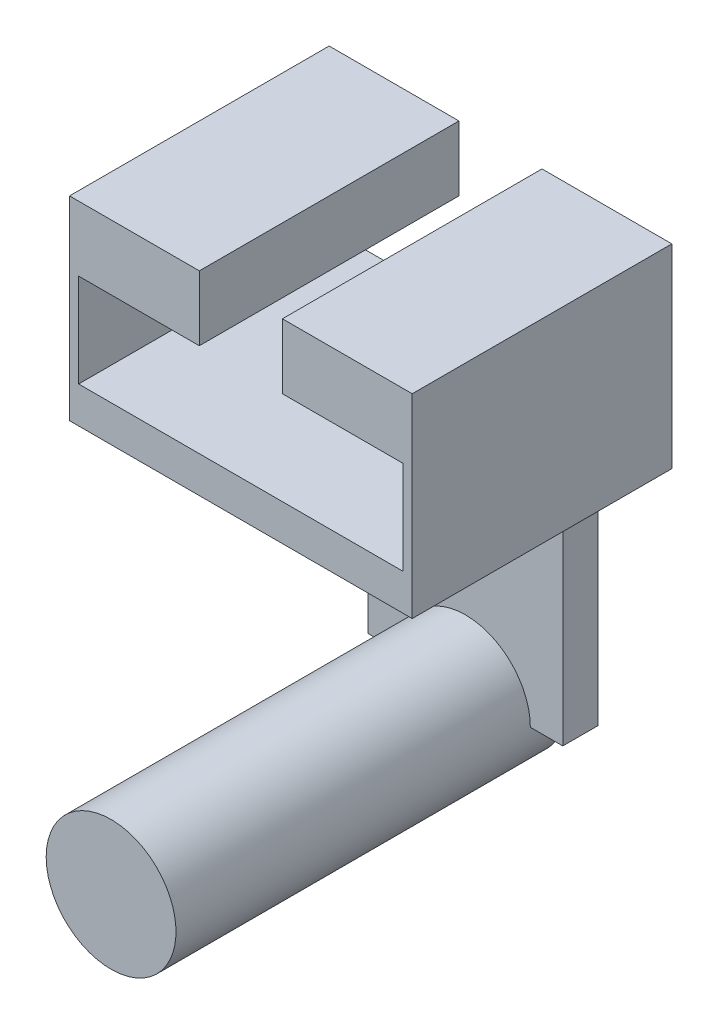
from build123d import *

# Parameters (mm, degrees)
BOSS_EXTRUDE4_DEPTH  = 6.858
SKETCH7_R            = 12.7
BOSS_EXTRUDE5_DEPTH  = 76.2
SKETCH9_W            = 63.5
SKETCH9_H            = 50.8
BOSS_EXTRUDE6_DEPTH  = 7.112
SKETCH11_W           = 50.8
SKETCH11_H           = 38.1
BOSS_EXTRUDE7_DEPTH  = 1.778
SKETCH12_W           = 50.8
SKETCH12_H           = 38.1
BOSS_EXTRUDE8_DEPTH  = 1.778
SKETCH14_W           = 25.4
SKETCH14_H           = 50.8
BOSS_EXTRUDE9_DEPTH  = 12.7
SKETCH15_W           = 25.4
SKETCH15_H           = 50.8
BOSS_EXTRUDE10_DEPTH = 12.7


with BuildPart() as part:
    # Sketch3 → Boss-Extrude4 (new body)
    with BuildSketch(Plane.XY):
        with BuildLine():
            Line((0, 0), (6.35, 0))
            ThreePointArc((6.35, 0), (19.05, 12.7), (31.75, 0))
            Line((31.75, 0), (38.1, 0))
            Line((38.1, 0), (38.1, 50.8))
            Line((38.1, 50.8), (0, 50.8))
            Line((0, 50.8), (0, 0))
        make_face()
    extrude(amount=BOSS_EXTRUDE4_DEPTH)

    # Sketch7 → Boss-Extrude5 (add)
    with BuildSketch(Plane(origin=(0, 0, 0), x_dir=(-1, 0, 0), z_dir=(0, 0, -1))):
        with Locations((-19.05, 0)):
            Circle(SKETCH7_R)
    extrude(amount=-BOSS_EXTRUDE5_DEPTH)

    # Sketch9 → Boss-Extrude6 (add)
    with BuildSketch(Plane(origin=(0, 50.8, 0), x_dir=(1, 0, 0), z_dir=(0, 1, 0))):
        with Locations((19.05, -25.4)):
            Rectangle(SKETCH9_W, SKETCH9_H)
    extrude(amount=BOSS_EXTRUDE6_DEPTH)

    # Sketch11 → Boss-Extrude7 (add)
    with BuildSketch(Plane(origin=(50.8, 0, 0), x_dir=(0, 0, -1), z_dir=(1, 0, 0))):
        with Locations((-25.4, 69.85)):
            Rectangle(SKETCH11_W, SKETCH11_H)
    extrude(amount=BOSS_EXTRUDE7_DEPTH)

    # Sketch12 → Boss-Extrude8 (add)
    with BuildSketch(Plane.ZY.offset(12.7)):
        with Locations((25.4, 69.85)):
            Rectangle(SKETCH12_W, SKETCH12_H)
    extrude(amount=BOSS_EXTRUDE8_DEPTH)

    # Sketch14 → Boss-Extrude9 (add)
    with BuildSketch(Plane(origin=(0, 88.9, 0), x_dir=(1, 0, 0), z_dir=(0, 1, 0))):
        with Locations((39.878, -25.4)):
            Rectangle(SKETCH14_W, SKETCH14_H)
    extrude(amount=-BOSS_EXTRUDE9_DEPTH)

    # Sketch15 → Boss-Extrude10 (add)
    with BuildSketch(Plane(origin=(0, 88.9, 0), x_dir=(1, 0, 0), z_dir=(0, 1, 0))):
        with Locations((-1.778, -25.4)):
            Rectangle(SKETCH15_W, SKETCH15_H)
    extrude(amount=-BOSS_EXTRUDE10_DEPTH)


solid = part.part
